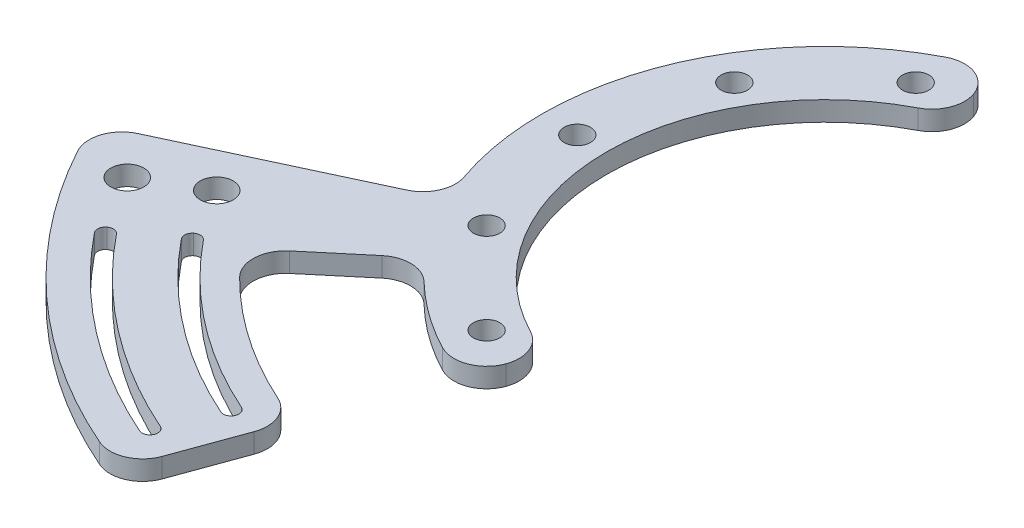
from build123d import *

# Parameters (mm, degrees)
SKETCH1_R               = 43.5
SKETCH1_R_2             = 33.5
BOSS_EXTRUDE1_DEPTH     = 3
SKETCH3_R               = 2.025
CUT_EXTRUDE2_DEPTH      = 62.591395503
CIRPATTERN1_COUNT       = 12
CUT_EXTRUDE1_DEPTH      = 62.591395503
BOSS_EXTRUDE2_DEPTH     = 3
CUT_EXTRUDE_THIN1_DEPTH = 3
FILLET1_R               = 1.2
FILLET2_R               = 5
CUT_EXTRUDE3_DEPTH      = 108.998410492
CUT_EXTRUDE3_DEPTH_BACK = 108.998410492
SKETCH6_R               = 2.525


with BuildPart() as part:
    # Sketch1 → Boss-Extrude1 (new body)
    with BuildSketch(Plane(origin=(0, 0, 0), x_dir=(1, 0, 0), z_dir=(0, 1, 0))):
        with Locations(Location((0, 0, 0), (0, 0, 270))):
            Circle(SKETCH1_R)
        with Locations(Location((0, 0, 0), (0, 0, 270))):
            Circle(SKETCH1_R_2, mode=Mode.SUBTRACT)
    extrude(amount=BOSS_EXTRUDE1_DEPTH)

    # Sketch3 → Cut-Extrude2 (cut, symmetric)
    with BuildSketch(Plane(origin=(0, 3, 0), x_dir=(1, 0, 0), z_dir=(0, 1, 0))):
        with Locations(Location((-38, 0, 0), (0, 0, 270))):
            Circle(SKETCH3_R)
    cut_extrude2 = extrude(amount=CUT_EXTRUDE2_DEPTH, both=True, mode=Mode.SUBTRACT)

    # CirPattern1: Cut-Extrude2 ×12 about axis
    cirpattern1_axis = Axis((0, 0, 0), (0, 1, 0))
    for i in range(1, CIRPATTERN1_COUNT):
        add(cut_extrude2.rotate(cirpattern1_axis, i * 360 / CIRPATTERN1_COUNT), mode=Mode.SUBTRACT)

    # Sketch2 → Cut-Extrude1 (cut, symmetric)
    with BuildSketch(Plane(origin=(0, 3, 0), x_dir=(1, 0, 0), z_dir=(0, 1, 0))):
        with BuildLine():
            Line((0, 0), (43.5, 0))
            ThreePointArc((43.5, 0), (24.950574981, -35.633113927), (-14.877876235, -40.876629004))
            Line((-14.877876235, -40.876629004), (0, 0))
        make_face()
    cut_extrude1 = extrude(amount=CUT_EXTRUDE1_DEPTH, both=True, mode=Mode.SUBTRACT)

    # Mirror1: Cut-Extrude1 across plane
    add(cut_extrude1.mirror(Plane.XY), mode=Mode.SUBTRACT)

    # Sketch4 → Boss-Extrude2 (add)
    with BuildSketch(Plane(origin=(0, 0, 0), x_dir=(1, 0, 0), z_dir=(0, 1, 0))):
        with BuildLine():
            ThreePointArc((-33.322933276, -27.961261021), (-36.687527893, -23.372532963), (-39.424388736, -18.383894386))
            Line((-39.424388736, -18.383894386), (-57.550544477, -26.836259621))
            Line((-57.550544477, -26.836259621), (-76.583008005, -35.711243117))
            ThreePointArc((-76.583008005, -35.711243117), (-57.087372544, -62.29993496), (-28.900702111, -79.404026456))
            Line((-28.900702111, -79.404026456), (-21.718279101, -59.67048142))
            ThreePointArc((-21.718279101, -59.67048142), (-36.422103708, -52.016154812), (-48.643822138, -40.817013215))
            Line((-48.643822138, -40.817013215), (-33.322933276, -27.961261021))
        make_face()
    extrude(amount=BOSS_EXTRUDE2_DEPTH)

    # Sketch5 → Cut-Extrude-Thin1 (cut)
    with BuildSketch(Plane(origin=(0, 3, 0), x_dir=(1, 0, 0), z_dir=(0, 1, 0))):
        with BuildLine():
            ThreePointArc((-55.318354903, -43.219435568), (-42.735052316, -55.693404488), (-27.42932522, -64.619440712))
            Line((-27.42932522, -64.619440712), (-26.491570512, -62.410229064))
            ThreePointArc((-26.491570512, -62.410229064), (-41.274024887, -53.789356472), (-53.427129095, -41.741848027))
            Line((-53.427129095, -41.741848027), (-55.318354903, -43.219435568))
        make_face()
        with BuildLine():
            ThreePointArc((-62.804457062, -49.068219583), (-48.518285892, -63.230261221), (-31.141270941, -73.36423682))
            Line((-31.141270941, -73.36423682), (-30.203516232, -71.155025172))
            ThreePointArc((-30.203516232, -71.155025172), (-47.057258462, -61.326213205), (-60.913231254, -47.590632043))
            Line((-60.913231254, -47.590632043), (-62.804457062, -49.068219583))
        make_face()
    extrude(amount=-CUT_EXTRUDE_THIN1_DEPTH, mode=Mode.SUBTRACT)

    # Fillet1
    fillet1_edges = [part.edges().sort_by_distance(p)[0] for p in [
        (-55.318354903, 1.5, 43.219435568),
        (-62.804457062, 1.5, 49.068219583),
        (-53.427129095, 1.5, 41.741848027),
        (-60.913231254, 1.5, 47.590632043),
        (-26.491570512, 1.5, 62.410229064),
        (-30.203516232, 1.5, 71.155025172),
        (-27.42932522, 1.5, 64.619440712),
        (-31.141270941, 1.5, 73.36423682),
    ]]
    fillet(fillet1_edges, radius=FILLET1_R - 0.0001)  # a hair under: the kernel refuses the full size

    # Fillet2
    fillet2_edges = [part.edges().sort_by_distance(p)[0] for p in [
        (-14.877876235, 1.5, -40.876629004),
        (-11.457674801, 1.5, -31.479702796),
        (-11.457674801, 1.5, 31.479702796),
        (-14.877876235, 1.5, 40.876629004),
        (-39.424388736, 1.5, 18.383894386),
        (-76.583008005, 1.5, 35.711243117),
        (-28.900702111, 1.5, 79.404026456),
        (-21.718279101, 1.5, 59.67048142),
        (-33.322933276, 1.5, 27.961261021),
        (-48.643822138, 1.5, 40.817013215),
    ]]
    fillet(fillet2_edges, radius=FILLET2_R - 0.0001)  # a hair under: the kernel refuses the full size

    # Sketch6 → Cut-Extrude3 (cut, two sides: drawn at the far end of the back side and taken through both)
    with BuildSketch(Plane(origin=(0, 3, 0), x_dir=(1, 0, 0), z_dir=(0, 1, 0)).offset(-CUT_EXTRUDE3_DEPTH_BACK)):
        with Locations(Location((-58.287376448, -35.022589094, 0), (0, 0, 270))):
            Circle(SKETCH6_R)
        with Locations(Location((-66.859049455, -40.172969843, 0), (0, 0, 270))):
            Circle(SKETCH6_R)
    extrude(amount=CUT_EXTRUDE3_DEPTH + CUT_EXTRUDE3_DEPTH_BACK, mode=Mode.SUBTRACT)


solid = part.part
